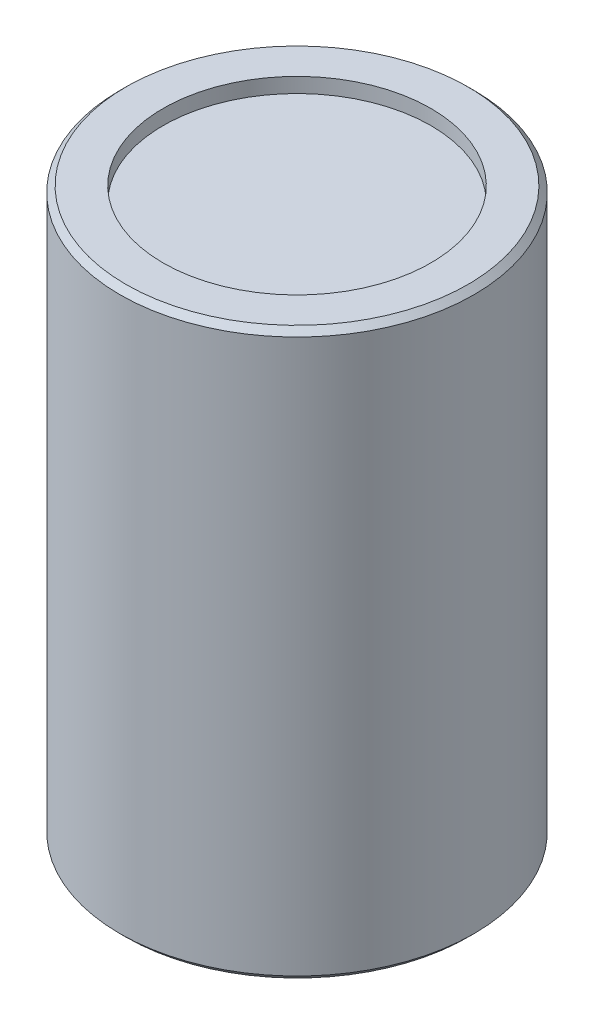
from build123d import *

# Parameters (mm, degrees)
IZIM1_R                     = 59.5
Y_KSEKLIK_EKSTR_ZYON1_DEPTH = 190
IZIM2_R                     = 45
KES_EKSTR_ZYON1_DEPTH       = 5
PAH1_SIZE                   = 2
PAH2_SIZE                   = 2
IZIM3_R                     = 45
Y_KSEKLIK_EKSTR_ZYON2_DEPTH = 6


with BuildPart() as part:
    # Çizim1 → Yükseklik-Ekstrüzyon1 (new body)
    with BuildSketch(Plane(origin=(0, 0, 0), x_dir=(1, 0, 0), z_dir=(0, 1, 0))):
        Circle(IZIM1_R)
    extrude(amount=Y_KSEKLIK_EKSTR_ZYON1_DEPTH)

    # Çizim2 → Kes-Ekstrüzyon1 (cut)
    with BuildSketch(Plane(origin=(0, 190, 0), x_dir=(1, 0, 0), z_dir=(0, 1, 0))):
        Circle(IZIM2_R)
    extrude(amount=-KES_EKSTR_ZYON1_DEPTH, mode=Mode.SUBTRACT)

    # Pah1
    pah1_edges = [part.edges().sort_by_distance(p)[0] for p in [
        (-59.5, 190, 0),
    ]]
    chamfer(pah1_edges, length=PAH1_SIZE)

    # Pah2
    pah2_edges = [part.edges().sort_by_distance(p)[0] for p in [
        (-59.5, 0, 0),
    ]]
    chamfer(pah2_edges, length=PAH2_SIZE)

    # Çizim3 → Yükseklik-Ekstrüzyon2 (add)
    with BuildSketch(Plane.XZ):
        Circle(IZIM3_R)
    extrude(amount=Y_KSEKLIK_EKSTR_ZYON2_DEPTH)


solid = part.part
